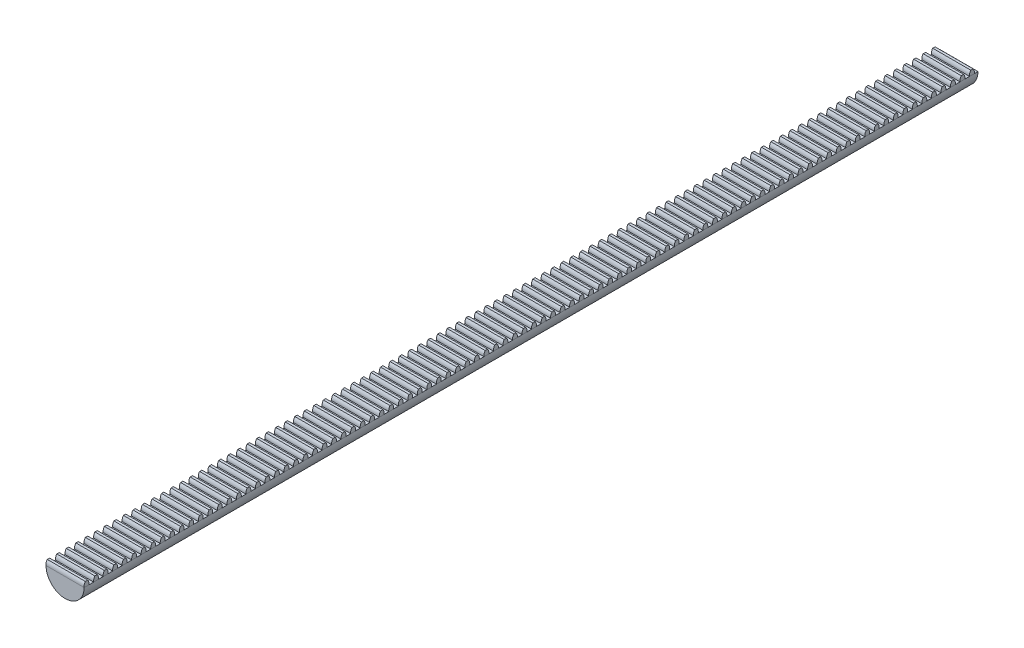
from build123d import *

# Parameters (mm, degrees)
BOSS_EXTRUDE1_DEPTH      = 825
BOSS_EXTRUDE1_DEPTH_BACK = 113.85759612
BOSS_EXTRUDE2_DEPTH      = 20
LPATTERN1_COUNT          = 94
LPATTERN1_PITCH          = 10


with BuildPart() as part:
    # Sketch1 → Boss-Extrude1 (new, two sides: drawn at the far end of the back side and taken through both)
    with BuildSketch(Plane.XY.offset(-BOSS_EXTRUDE1_DEPTH_BACK)):
        with BuildLine():
            Line((-20, 0), (20, 0))
            ThreePointArc((20, 0), (0, -20), (-20, 0))
        make_face()
    extrude(amount=BOSS_EXTRUDE1_DEPTH + BOSS_EXTRUDE1_DEPTH_BACK)

    # Sketch2 → Boss-Extrude2 (add, symmetric)
    with BuildSketch(Plane(origin=(0, 0, 0), x_dir=(0, 0, -1), z_dir=(1, 0, 0))):
        with BuildLine():
            Line((-823.75, 5), (-821.25, 5))
            add(Edge.make_bspline(
                [(-821.25, 5), (-819.623113342, 2.850447451), (-820, 0)],
                knots=[0, 0, 0, 1, 1, 1], degree=2))
            Line((-820, 0), (-825, 0))
            add(Edge.make_bspline(
                [(-825, 0), (-825.376886658, 2.850447451), (-823.75, 5)],
                knots=[0, 0, 0, 1, 1, 1], degree=2))
        make_face()
    boss_extrude2 = extrude(amount=BOSS_EXTRUDE2_DEPTH, both=True)

    # LPattern1: Boss-Extrude2 ×94
    with Locations(*[(0, 0, -i * LPATTERN1_PITCH) for i in range(1, LPATTERN1_COUNT)]):
        add(boss_extrude2)


solid = part.part
